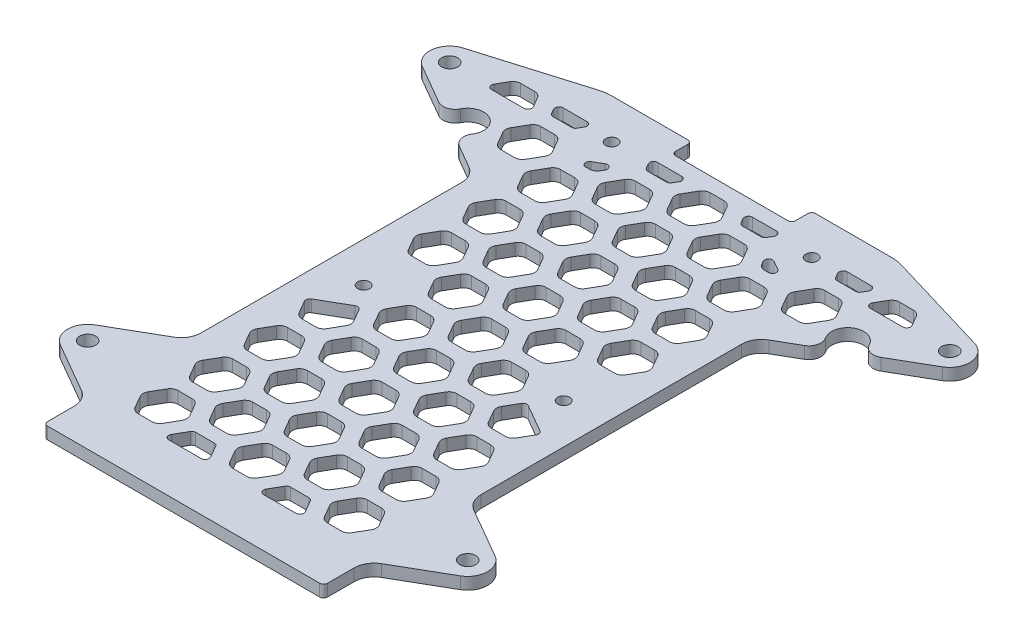
from build123d import *

# Parameters (mm, degrees)
SKETCH_2_R          = 1.5
SKETCH_2_R_2        = 2
EXTRUDE_1_DEPTH     = 3
SKETCH_5_W          = 30
SKETCH_5_H          = 5
CUT_EXTRUDE_4_DEPTH = 149.287727071
FILLET_2_R          = 1
FILLET_1_R          = 2


with BuildPart() as part:
    # 草图2 → 凸台-拉伸1 (new body)
    with BuildSketch(Plane(origin=(0, 0, 0), x_dir=(1, 0, 0), z_dir=(0, 1, 0))):
        with BuildLine():
            Line((-43.151430903, -19.944404268), (-37.5, -23.207259422))
            ThreePointArc((-37.5, -23.207259422), (-35.669872981, -25.037386441), (-35, -27.537386441))
            Line((-35, -27.537386441), (-35, -92.622867597))
            ThreePointArc((-35, -92.622867597), (-35.669872981, -95.122867597), (-37.5, -96.952994616))
            Line((-37.5, -96.952994616), (-50, -104.169872981))
            ThreePointArc((-50, -104.169872981), (-52.5, -108.5), (-50, -112.830127019))
            Line((-50, -112.830127019), (-37.5, -120.047005384))
            ThreePointArc((-37.5, -120.047005384), (-35.669872981, -121.877132403), (-35, -124.377132403))
            Line((-35, -124.377132403), (-35, -132))
            Line((-35, -132), (35, -132))
            Line((35, -132), (35, -124.377132403))
            ThreePointArc((35, -124.377132403), (35.669872981, -121.877132403), (37.5, -120.047005384))
            Line((37.5, -120.047005384), (50, -112.830127019))
            ThreePointArc((50, -112.830127019), (52.5, -108.5), (50, -104.169872981))
            Line((50, -104.169872981), (37.5, -96.952994616))
            ThreePointArc((37.5, -96.952994616), (35.669872981, -95.122867597), (35, -92.622867597))
            Line((35, -92.622867597), (35, -27.537386441))
            ThreePointArc((35, -27.537386441), (35.669872981, -25.037386441), (37.5, -23.207259422))
            Line((37.5, -23.207259422), (43.151430903, -19.944404268))
            ThreePointArc((43.151430903, -19.944404268), (44.570551627, -18.038234264), (44.157960516, -15.697901747))
            ThreePointArc((44.157960516, -15.697901747), (45.5, -10.035898385), (51.07445849, -11.70465978))
            ThreePointArc((51.07445849, -11.70465978), (52.894950347, -13.232140422), (55.255302357, -12.956230826))
            Line((55.255302357, -12.956230826), (65, -7.330127019))
            ThreePointArc((65, -7.330127019), (67.466051679, -2.418337963), (63.931706025, 1.790638565))
            Line((63.931706025, 1.790638565), (37.86341205, 9.581277129))
            ThreePointArc((37.86341205, 9.581277129), (36.44693274, 9.894765568), (35, 10))
            Line((35, 10), (-35, 10))
            ThreePointArc((-35, 10), (-36.44693274, 9.894765568), (-37.86341205, 9.581277129))
            Line((-37.86341205, 9.581277129), (-63.931706025, 1.790638565))
            ThreePointArc((-63.931706025, 1.790638565), (-67.466051679, -2.418337963), (-65, -7.330127019))
            Line((-65, -7.330127019), (-55.255302357, -12.956230826))
            ThreePointArc((-55.255302357, -12.956230826), (-52.894950347, -13.232140422), (-51.07445849, -11.70465978))
            ThreePointArc((-51.07445849, -11.70465978), (-45.5, -10.035898385), (-44.157960516, -15.697901747))
            ThreePointArc((-44.157960516, -15.697901747), (-44.570551627, -18.038234264), (-43.151430903, -19.944404268))
        make_face()
        with Locations(Location((-25, 0, 0), (0, 0, 270))):
            Circle(SKETCH_2_R, mode=Mode.SUBTRACT)
        with Locations(Location((-62.5, -3, 0), (0, 0, 270))):
            Circle(SKETCH_2_R_2, mode=Mode.SUBTRACT)
        with Locations(Location((62.5, -3, 0), (0, 0, 90))):
            Circle(SKETCH_2_R_2, mode=Mode.SUBTRACT)
        with Locations(Location((25, 0, 0), (0, 0, 270))):
            Circle(SKETCH_2_R, mode=Mode.SUBTRACT)
        with Locations(Location((-25, -62, 0), (0, 0, 270))):
            Circle(SKETCH_2_R, mode=Mode.SUBTRACT)
        with Locations(Location((25, -62, 0), (0, 0, 270))):
            Circle(SKETCH_2_R, mode=Mode.SUBTRACT)
        with Locations(Location((-47.5, -108.5, 0), (0, 0, 270))):
            Circle(SKETCH_2_R_2, mode=Mode.SUBTRACT)
        with Locations(Location((47.5, -108.5, 0), (0, 0, 90))):
            Circle(SKETCH_2_R_2, mode=Mode.SUBTRACT)
    extrude(amount=EXTRUDE_1_DEPTH)

    # 草图5 → 切除-拉伸4 (cut, through all)
    with BuildSketch(Plane(origin=(0, 3, 0), x_dir=(1, 0, 0), z_dir=(0, 1, 0))):
        Polygon((-20.784609691, -12.333333333), (-26.558112383, -12.333333333), (-29.444863729, -17.333333333), (-26.558112383, -22.333333333), (-20.784609691, -22.333333333), (-17.897858345, -17.333333333), align=None)
        with Locations((0, 7.5)):
            Rectangle(SKETCH_5_W, SKETCH_5_H)
        Polygon((2.886751346, -12.333333333), (-2.886751346, -12.333333333), (-5.773502692, -17.333333333), (-2.886751346, -22.333333333), (2.886751346, -22.333333333), (5.773502692, -17.333333333), align=None)
        Polygon((-8.948929172, -19.166666667), (-14.722431864, -19.166666667), (-17.60918321, -24.166666667), (-14.722431864, -29.166666667), (-8.948929172, -29.166666667), (-6.062177826, -24.166666667), align=None)
        Polygon((-8.948929172, -5.5), (-14.722431864, -5.5), (-17.60918321, -10.5), (-14.722431864, -15.5), (-8.948929172, -15.5), (-6.062177826, -10.5), align=None)
        Polygon((2.886751346, 1.333333333), (-2.886751346, 1.333333333), (-5.773502692, -3.666666667), (-2.886751346, -8.666666667), (2.886751346, -8.666666667), (5.773502692, -3.666666667), align=None)
        Polygon((-32.620290209, -5.5), (-38.393792901, -5.5), (-41.280544247, -10.5), (-38.393792901, -15.5), (-32.620290209, -15.5), (-29.733538863, -10.5), align=None)
        Polygon((-26.558112383, -8.666666667), (-20.784609691, -8.666666667), (-17.897858345, -3.666666667), align=None)
        Polygon((-44.455970728, 1.333333333), (-50.229473419, 1.333333333), (-53.116224765, -3.666666667), (-41.569219382, -3.666666667), align=None)
        Polygon((-20.784609691, -39.666666667), (-26.558112383, -39.666666667), (-29.444863729, -44.666666667), (-26.558112383, -49.666666667), (-20.784609691, -49.666666667), (-17.897858345, -44.666666667), align=None)
        Polygon((-20.784609691, -26), (-26.558112383, -26), (-29.444863729, -31), (-26.558112383, -36), (-20.784609691, -36), (-17.897858345, -31), align=None)
        Polygon((-29.444863729, -72), (-26.558112383, -77), (-20.784609691, -77), (-17.897858345, -72), (-20.784609691, -67), align=None)
        Polygon((-20.784609691, -94.333333333), (-26.558112383, -94.333333333), (-29.444863729, -99.333333333), (-26.558112383, -104.333333333), (-20.784609691, -104.333333333), (-17.897858345, -99.333333333), align=None)
        Polygon((-20.784609691, -80.666666667), (-26.558112383, -80.666666667), (-29.444863729, -85.666666667), (-26.558112383, -90.666666667), (-20.784609691, -90.666666667), (-17.897858345, -85.666666667), align=None)
        Polygon((-20.784609691, -108), (-26.558112383, -108), (-29.444863729, -113), (-26.558112383, -118), (-20.784609691, -118), (-17.897858345, -113), align=None)
        Polygon((2.886751346, -39.666666667), (-2.886751346, -39.666666667), (-5.773502692, -44.666666667), (-2.886751346, -49.666666667), (2.886751346, -49.666666667), (5.773502692, -44.666666667), align=None)
        Polygon((-8.948929172, -46.5), (-14.722431864, -46.5), (-17.60918321, -51.5), (-14.722431864, -56.5), (-8.948929172, -56.5), (-6.062177826, -51.5), align=None)
        Polygon((-8.948929172, -32.833333333), (-14.722431864, -32.833333333), (-17.60918321, -37.833333333), (-14.722431864, -42.833333333), (-8.948929172, -42.833333333), (-6.062177826, -37.833333333), align=None)
        Polygon((2.886751346, -26), (-2.886751346, -26), (-5.773502692, -31), (-2.886751346, -36), (2.886751346, -36), (5.773502692, -31), align=None)
        Polygon((2.886751346, -67), (-2.886751346, -67), (-5.773502692, -72), (-2.886751346, -77), (2.886751346, -77), (5.773502692, -72), align=None)
        Polygon((-8.948929172, -73.833333333), (-14.722431864, -73.833333333), (-17.60918321, -78.833333333), (-14.722431864, -83.833333333), (-8.948929172, -83.833333333), (-6.062177826, -78.833333333), align=None)
        Polygon((-8.948929172, -60.166666667), (-14.722431864, -60.166666667), (-17.60918321, -65.166666667), (-14.722431864, -70.166666667), (-8.948929172, -70.166666667), (-6.062177826, -65.166666667), align=None)
        Polygon((2.886751346, -53.333333333), (-2.886751346, -53.333333333), (-5.773502692, -58.333333333), (-2.886751346, -63.333333333), (2.886751346, -63.333333333), (5.773502692, -58.333333333), align=None)
        Polygon((2.886751346, -94.333333333), (-2.886751346, -94.333333333), (-5.773502692, -99.333333333), (-2.886751346, -104.333333333), (2.886751346, -104.333333333), (5.773502692, -99.333333333), align=None)
        Polygon((-8.948929172, -101.166666667), (-14.722431864, -101.166666667), (-17.60918321, -106.166666667), (-14.722431864, -111.166666667), (-8.948929172, -111.166666667), (-6.062177826, -106.166666667), align=None)
        Polygon((-8.948929172, -87.5), (-14.722431864, -87.5), (-17.60918321, -92.5), (-14.722431864, -97.5), (-8.948929172, -97.5), (-6.062177826, -92.5), align=None)
        Polygon((2.886751346, -80.666666667), (-2.886751346, -80.666666667), (-5.773502692, -85.666666667), (-2.886751346, -90.666666667), (2.886751346, -90.666666667), (5.773502692, -85.666666667), align=None)
        Polygon((-8.948929172, -114.833333333), (-14.722431864, -114.833333333), (-17.60918321, -119.833333333), (-6.062177826, -119.833333333), align=None)
        Polygon((2.886751346, -108), (-2.886751346, -108), (-5.773502692, -113), (-2.886751346, -118), (2.886751346, -118), (5.773502692, -113), align=None)
        Polygon((-16.550707717, 1.333333333), (-14.722431864, -1.833333333), (-8.948929172, -1.833333333), (-7.12065332, 1.333333333), align=None)
        Polygon((-40.222068754, 1.333333333), (-30.792014357, 1.333333333), (-32.620290209, -1.833333333), (-38.393792901, -1.833333333), align=None)
    cut_extrude_4 = extrude(amount=-CUT_EXTRUDE_4_DEPTH, mode=Mode.SUBTRACT)

    # 镜向1: 切除-拉伸4 across plane
    add(cut_extrude_4.mirror(Plane(origin=(0, 0, 0), x_dir=(0, 0, 1), z_dir=(1, 0, 0))), mode=Mode.SUBTRACT)

    # 圆角2
    fillet_2_edges = [part.edges().sort_by_distance(p)[0] for p in [
        (7.12065332, 1.5, -1.333333333),
        (16.550707717, 1.5, -1.333333333),
        (14.722431864, 1.5, 1.833333333),
        (8.948929172, 1.5, 1.833333333),
        (-29.444863729, 1.5, 72),
        (-20.784609691, 1.5, 67),
        (-41.569219382, 1.5, 3.666666667),
        (-53.116224765, 1.5, 3.666666667),
        (-38.393792901, 1.5, 1.833333333),
        (-40.222068754, 1.5, -1.333333333),
        (-30.792014357, 1.5, -1.333333333),
        (-32.620290209, 1.5, 1.833333333),
        (-15, 1.5, -5),
        (-15, 1.5, -10),
        (15, 1.5, -10),
        (15, 1.5, -5),
        (-26.558112383, 1.5, 8.666666667),
        (-17.897858345, 1.5, 3.666666667),
        (-8.948929172, 1.5, 114.833333333),
        (-6.062177826, 1.5, 119.833333333),
        (-17.60918321, 1.5, 119.833333333),
        (-14.722431864, 1.5, 114.833333333),
        (-16.550707717, 1.5, -1.333333333),
        (-7.12065332, 1.5, -1.333333333),
        (-8.948929172, 1.5, 1.833333333),
        (-14.722431864, 1.5, 1.833333333),
        (35, 1.5, 132),
        (-35, 1.5, 132),
        (20.784609691, 1.5, 67),
        (29.444863729, 1.5, 72),
        (41.569219382, 1.5, 3.666666667),
        (53.116224765, 1.5, 3.666666667),
        (40.222068754, 1.5, -1.333333333),
        (38.393792901, 1.5, 1.833333333),
        (32.620290209, 1.5, 1.833333333),
        (30.792014357, 1.5, -1.333333333),
        (17.897858345, 1.5, 3.666666667),
        (26.558112383, 1.5, 8.666666667),
        (6.062177826, 1.5, 119.833333333),
        (8.948929172, 1.5, 114.833333333),
        (14.722431864, 1.5, 114.833333333),
        (17.60918321, 1.5, 119.833333333),
    ]]
    fillet(fillet_2_edges, radius=FILLET_2_R)

    # 圆角1
    fillet_1_edges = [part.edges().sort_by_distance(p)[0] for p in [
        (6.062177826, 1.5, 37.833333333),
        (8.948929172, 1.5, 32.833333333),
        (14.722431864, 1.5, 32.833333333),
        (17.60918321, 1.5, 37.833333333),
        (14.722431864, 1.5, 42.833333333),
        (8.948929172, 1.5, 42.833333333),
        (6.062177826, 1.5, 51.5),
        (8.948929172, 1.5, 46.5),
        (14.722431864, 1.5, 46.5),
        (17.60918321, 1.5, 51.5),
        (14.722431864, 1.5, 56.5),
        (8.948929172, 1.5, 56.5),
        (6.062177826, 1.5, 65.166666667),
        (8.948929172, 1.5, 60.166666667),
        (14.722431864, 1.5, 60.166666667),
        (17.60918321, 1.5, 65.166666667),
        (14.722431864, 1.5, 70.166666667),
        (8.948929172, 1.5, 70.166666667),
        (6.062177826, 1.5, 78.833333333),
        (8.948929172, 1.5, 73.833333333),
        (14.722431864, 1.5, 73.833333333),
        (17.60918321, 1.5, 78.833333333),
        (14.722431864, 1.5, 83.833333333),
        (8.948929172, 1.5, 83.833333333),
        (-17.897858345, 1.5, 72),
        (-20.784609691, 1.5, 77),
        (-26.558112383, 1.5, 77),
        (-20.784609691, 1.5, 94.333333333),
        (-17.897858345, 1.5, 99.333333333),
        (-20.784609691, 1.5, 104.333333333),
        (-26.558112383, 1.5, 104.333333333),
        (-29.444863729, 1.5, 99.333333333),
        (-26.558112383, 1.5, 94.333333333),
        (-20.784609691, 1.5, 80.666666667),
        (-17.897858345, 1.5, 85.666666667),
        (-20.784609691, 1.5, 90.666666667),
        (-26.558112383, 1.5, 90.666666667),
        (-29.444863729, 1.5, 85.666666667),
        (-26.558112383, 1.5, 80.666666667),
        (-20.784609691, 1.5, 108),
        (-17.897858345, 1.5, 113),
        (-20.784609691, 1.5, 118),
        (-26.558112383, 1.5, 118),
        (-29.444863729, 1.5, 113),
        (-26.558112383, 1.5, 108),
        (-20.784609691, 1.5, 26),
        (-17.897858345, 1.5, 31),
        (-20.784609691, 1.5, 36),
        (-26.558112383, 1.5, 36),
        (-29.444863729, 1.5, 31),
        (-26.558112383, 1.5, 26),
        (-20.784609691, 1.5, 39.666666667),
        (-17.897858345, 1.5, 44.666666667),
        (-20.784609691, 1.5, 49.666666667),
        (-26.558112383, 1.5, 49.666666667),
        (-29.444863729, 1.5, 44.666666667),
        (-26.558112383, 1.5, 39.666666667),
        (-44.455970728, 1.5, -1.333333333),
        (-50.229473419, 1.5, -1.333333333),
        (-8.948929172, 1.5, 19.166666667),
        (-6.062177826, 1.5, 24.166666667),
        (-8.948929172, 1.5, 29.166666667),
        (-14.722431864, 1.5, 29.166666667),
        (-17.60918321, 1.5, 24.166666667),
        (-14.722431864, 1.5, 19.166666667),
        (2.886751346, 1.5, 12.333333333),
        (5.773502692, 1.5, 17.333333333),
        (2.886751346, 1.5, 22.333333333),
        (-2.886751346, 1.5, 22.333333333),
        (-5.773502692, 1.5, 17.333333333),
        (-2.886751346, 1.5, 12.333333333),
        (-20.784609691, 1.5, 12.333333333),
        (-17.897858345, 1.5, 17.333333333),
        (-20.784609691, 1.5, 22.333333333),
        (-26.558112383, 1.5, 22.333333333),
        (-29.444863729, 1.5, 17.333333333),
        (-26.558112383, 1.5, 12.333333333),
        (-8.948929172, 1.5, 5.5),
        (-6.062177826, 1.5, 10.5),
        (-8.948929172, 1.5, 15.5),
        (-14.722431864, 1.5, 15.5),
        (-17.60918321, 1.5, 10.5),
        (-14.722431864, 1.5, 5.5),
        (2.886751346, 1.5, -1.333333333),
        (5.773502692, 1.5, 3.666666667),
        (2.886751346, 1.5, 8.666666667),
        (-2.886751346, 1.5, 8.666666667),
        (-5.773502692, 1.5, 3.666666667),
        (-2.886751346, 1.5, -1.333333333),
        (-32.620290209, 1.5, 5.5),
        (-29.733538863, 1.5, 10.5),
        (-32.620290209, 1.5, 15.5),
        (-38.393792901, 1.5, 15.5),
        (-41.280544247, 1.5, 10.5),
        (-38.393792901, 1.5, 5.5),
        (-20.784609691, 1.5, 8.666666667),
        (2.886751346, 1.5, 80.666666667),
        (5.773502692, 1.5, 85.666666667),
        (2.886751346, 1.5, 90.666666667),
        (-2.886751346, 1.5, 90.666666667),
        (-5.773502692, 1.5, 85.666666667),
        (-2.886751346, 1.5, 80.666666667),
        (-8.948929172, 1.5, 87.5),
        (-6.062177826, 1.5, 92.5),
        (-8.948929172, 1.5, 97.5),
        (-14.722431864, 1.5, 97.5),
        (-17.60918321, 1.5, 92.5),
        (-14.722431864, 1.5, 87.5),
        (-8.948929172, 1.5, 101.166666667),
        (-6.062177826, 1.5, 106.166666667),
        (-8.948929172, 1.5, 111.166666667),
        (-14.722431864, 1.5, 111.166666667),
        (-17.60918321, 1.5, 106.166666667),
        (-14.722431864, 1.5, 101.166666667),
        (2.886751346, 1.5, 94.333333333),
        (5.773502692, 1.5, 99.333333333),
        (2.886751346, 1.5, 104.333333333),
        (-2.886751346, 1.5, 104.333333333),
        (-5.773502692, 1.5, 99.333333333),
        (-2.886751346, 1.5, 94.333333333),
        (2.886751346, 1.5, 108),
        (5.773502692, 1.5, 113),
        (2.886751346, 1.5, 118),
        (-2.886751346, 1.5, 118),
        (-5.773502692, 1.5, 113),
        (-2.886751346, 1.5, 108),
        (2.886751346, 1.5, 26),
        (5.773502692, 1.5, 31),
        (2.886751346, 1.5, 36),
        (-2.886751346, 1.5, 36),
        (-5.773502692, 1.5, 31),
        (-2.886751346, 1.5, 26),
        (-8.948929172, 1.5, 32.833333333),
        (-6.062177826, 1.5, 37.833333333),
        (-8.948929172, 1.5, 42.833333333),
        (-14.722431864, 1.5, 42.833333333),
        (-17.60918321, 1.5, 37.833333333),
        (-14.722431864, 1.5, 32.833333333),
        (-8.948929172, 1.5, 46.5),
        (-6.062177826, 1.5, 51.5),
        (-8.948929172, 1.5, 56.5),
        (-14.722431864, 1.5, 56.5),
        (-17.60918321, 1.5, 51.5),
        (-14.722431864, 1.5, 46.5),
        (2.886751346, 1.5, 39.666666667),
        (5.773502692, 1.5, 44.666666667),
        (2.886751346, 1.5, 49.666666667),
        (-2.886751346, 1.5, 49.666666667),
        (-5.773502692, 1.5, 44.666666667),
        (-2.886751346, 1.5, 39.666666667),
        (2.886751346, 1.5, 53.333333333),
        (5.773502692, 1.5, 58.333333333),
        (2.886751346, 1.5, 63.333333333),
        (-2.886751346, 1.5, 63.333333333),
        (-5.773502692, 1.5, 58.333333333),
        (-2.886751346, 1.5, 53.333333333),
        (-8.948929172, 1.5, 60.166666667),
        (-6.062177826, 1.5, 65.166666667),
        (-8.948929172, 1.5, 70.166666667),
        (-14.722431864, 1.5, 70.166666667),
        (-17.60918321, 1.5, 65.166666667),
        (-14.722431864, 1.5, 60.166666667),
        (-8.948929172, 1.5, 73.833333333),
        (-6.062177826, 1.5, 78.833333333),
        (-8.948929172, 1.5, 83.833333333),
        (-14.722431864, 1.5, 83.833333333),
        (-17.60918321, 1.5, 78.833333333),
        (-14.722431864, 1.5, 73.833333333),
        (2.886751346, 1.5, 67),
        (5.773502692, 1.5, 72),
        (2.886751346, 1.5, 77),
        (-2.886751346, 1.5, 77),
        (-5.773502692, 1.5, 72),
        (-2.886751346, 1.5, 67),
        (26.558112383, 1.5, 77),
        (20.784609691, 1.5, 77),
        (17.897858345, 1.5, 72),
        (17.897858345, 1.5, 99.333333333),
        (20.784609691, 1.5, 94.333333333),
        (26.558112383, 1.5, 94.333333333),
        (29.444863729, 1.5, 99.333333333),
        (26.558112383, 1.5, 104.333333333),
        (20.784609691, 1.5, 104.333333333),
        (17.897858345, 1.5, 85.666666667),
        (20.784609691, 1.5, 80.666666667),
        (26.558112383, 1.5, 80.666666667),
        (29.444863729, 1.5, 85.666666667),
        (26.558112383, 1.5, 90.666666667),
        (20.784609691, 1.5, 90.666666667),
        (17.897858345, 1.5, 113),
        (20.784609691, 1.5, 108),
        (26.558112383, 1.5, 108),
        (29.444863729, 1.5, 113),
        (26.558112383, 1.5, 118),
        (20.784609691, 1.5, 118),
        (17.897858345, 1.5, 31),
        (20.784609691, 1.5, 26),
        (26.558112383, 1.5, 26),
        (29.444863729, 1.5, 31),
        (26.558112383, 1.5, 36),
        (20.784609691, 1.5, 36),
        (17.897858345, 1.5, 44.666666667),
        (20.784609691, 1.5, 39.666666667),
        (26.558112383, 1.5, 39.666666667),
        (29.444863729, 1.5, 44.666666667),
        (26.558112383, 1.5, 49.666666667),
        (20.784609691, 1.5, 49.666666667),
        (44.455970728, 1.5, -1.333333333),
        (50.229473419, 1.5, -1.333333333),
        (6.062177826, 1.5, 24.166666667),
        (8.948929172, 1.5, 19.166666667),
        (14.722431864, 1.5, 19.166666667),
        (17.60918321, 1.5, 24.166666667),
        (14.722431864, 1.5, 29.166666667),
        (8.948929172, 1.5, 29.166666667),
        (17.897858345, 1.5, 17.333333333),
        (20.784609691, 1.5, 12.333333333),
        (26.558112383, 1.5, 12.333333333),
        (29.444863729, 1.5, 17.333333333),
        (26.558112383, 1.5, 22.333333333),
        (20.784609691, 1.5, 22.333333333),
        (6.062177826, 1.5, 10.5),
        (8.948929172, 1.5, 5.5),
        (14.722431864, 1.5, 5.5),
        (17.60918321, 1.5, 10.5),
        (14.722431864, 1.5, 15.5),
        (8.948929172, 1.5, 15.5),
        (29.733538863, 1.5, 10.5),
        (32.620290209, 1.5, 5.5),
        (38.393792901, 1.5, 5.5),
        (41.280544247, 1.5, 10.5),
        (38.393792901, 1.5, 15.5),
        (32.620290209, 1.5, 15.5),
        (20.784609691, 1.5, 8.666666667),
        (6.062177826, 1.5, 92.5),
        (8.948929172, 1.5, 87.5),
        (14.722431864, 1.5, 87.5),
        (17.60918321, 1.5, 92.5),
        (14.722431864, 1.5, 97.5),
        (8.948929172, 1.5, 97.5),
        (6.062177826, 1.5, 106.166666667),
        (8.948929172, 1.5, 101.166666667),
        (14.722431864, 1.5, 101.166666667),
        (17.60918321, 1.5, 106.166666667),
        (14.722431864, 1.5, 111.166666667),
        (8.948929172, 1.5, 111.166666667),
    ]]
    fillet(fillet_1_edges, radius=FILLET_1_R)


solid = part.part
